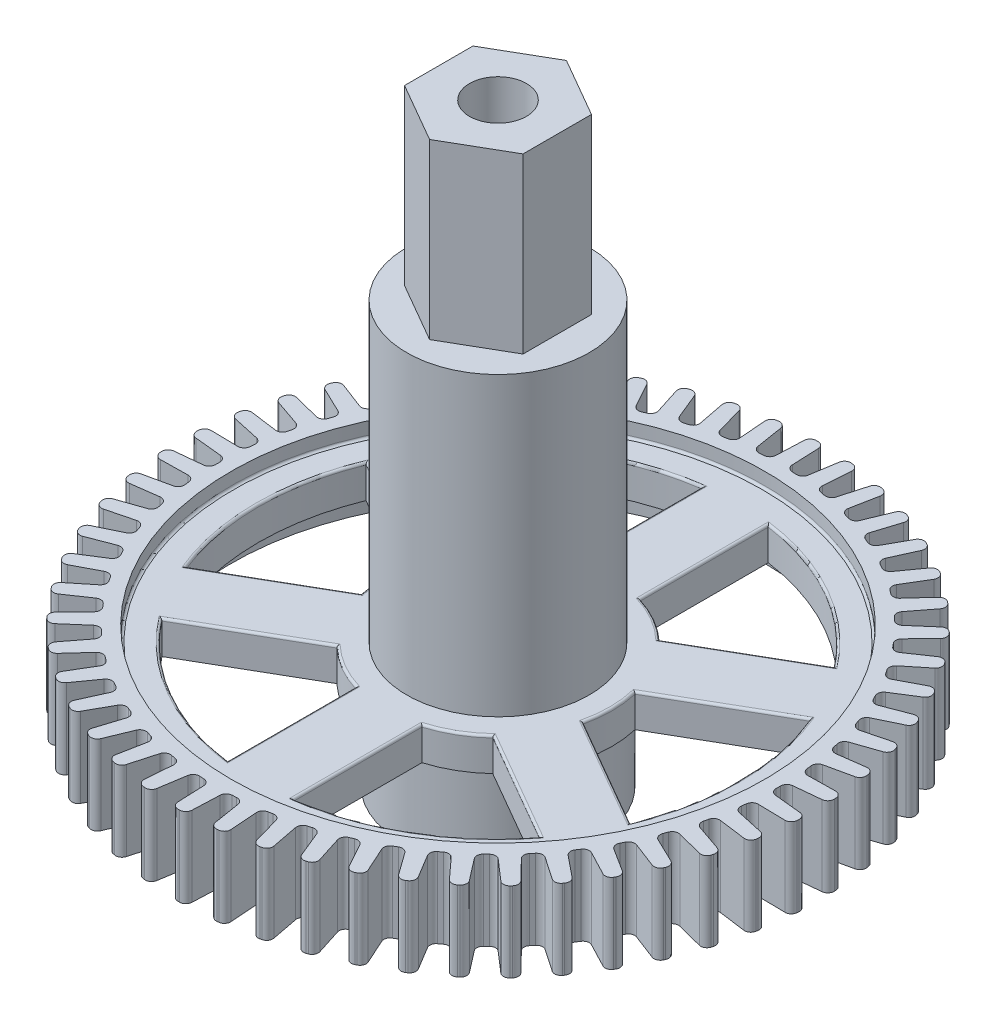
from build123d import *

# Parameters (mm, degrees)
RESSALTO_EXTRUS_O1_DEPTH = 3.5
ESBO_O2_R                = 11.7
CORTE_EXTRUS_O1_DEPTH    = 0.65
FILETE2_R                = 0.1
CORTE_EXTRUS_O2_DEPTH    = 20.983788233
FILETE3_R                = 0.1
CORTE_EXTRUS_O3_START    = -1.4
ESBO_O4_R                = 11.7
CORTE_EXTRUS_O3_DEPTH    = 1.4
ESBO_O5_R                = 4.25
RESSALTO_EXTRUS_O2_DEPTH = 4
ESBO_O6_R                = 4
RESSALTO_EXTRUS_O3_DEPTH = 13
RESSALTO_EXTRUS_O4_DEPTH = 7.6
ESBO_O8_R                = 1.25
CORTE_EXTRUS_O4_DEPTH    = 33.708283234


with BuildPart() as part:
    # Esboço1 → Ressalto-extrusão1 (new body)
    with BuildSketch(Plane(origin=(0, 0, 0), x_dir=(1, 0, 0), z_dir=(0, 1, 0))):
        with BuildLine():
            Line((0.036075499, 13.996785345), (-0.036075497, 13.996785345))
            ThreePointArc((-0.036075497, 13.996785345), (-0.226493402, 13.920194069), (-0.310843304, 13.733083684))
            Line((-0.310843304, 13.733083684), (-0.359771088, 12.543193769))
            ThreePointArc((-0.359771088, 12.543193769), (-0.438430885, 12.361705573), (-0.618549068, 12.279957365))
            Line((-0.618549068, 12.279957365), (-0.811249358, 12.268733852))
            ThreePointArc((-0.811249358, 12.268733852), (-0.999640035, 12.329018866), (-1.098837471, 12.500148053))
            Line((-1.098837471, 12.500148053), (-1.285572211, 13.676312191))
            ThreePointArc((-1.285572211, 13.676312191), (-1.391073959, 13.852364976), (-1.58909603, 13.9063322))
            Line((-1.58909603, 13.9063322), (-1.660759167, 13.89795598))
            ThreePointArc((-1.660759167, 13.89795598), (-1.840997829, 13.799776417), (-1.903055198, 13.604138781))
            Line((-1.903055198, 13.604138781), (-1.813514362, 12.416614306))
            ThreePointArc((-1.813514362, 12.416614306), (-1.870572796, 12.227221423), (-2.039982696, 12.125115523))
            Line((-2.039982696, 12.125115523), (-2.230077045, 12.091596761))
            ThreePointArc((-2.230077045, 12.091596761), (-2.424192555, 12.129603326), (-2.542586139, 12.28805928))
            Line((-2.542586139, 12.28805928), (-2.864602568, 13.434592036))
            ThreePointArc((-2.864602568, 13.434592036), (-2.989829432, 13.59720641), (-3.192777761, 13.627819767))
            Line((-3.192777761, 13.627819767), (-3.262983918, 13.611180603))
            ThreePointArc((-3.262983918, 13.611180603), (-3.430605919, 13.492740463), (-3.469531534, 13.291221237))
            Line((-3.469531534, 13.291221237), (-3.242732965, 12.122121435))
            ThreePointArc((-3.242732965, 12.122121435), (-3.277418418, 11.927385079), (-3.433829058, 11.806302293))
            Line((-3.433829058, 11.806302293), (-3.618746766, 11.750941566))
            ThreePointArc((-3.618746766, 11.750941566), (-3.81596203, 11.766155709), (-3.951950692, 11.909795585))
            Line((-3.951950692, 11.909795585), (-4.40489409, 13.011192071))
            ThreePointArc((-4.40489409, 13.011192071), (-4.548152591, 13.158168953), (-4.75328265, 13.165014451))
            Line((-4.75328265, 13.165014451), (-4.821082408, 13.140337357))
            ThreePointArc((-4.821082408, 13.140337357), (-4.973820949, 13.003238341), (-4.989088409, 12.798562728))
            Line((-4.989088409, 12.798562728), (-4.628099168, 11.663697667))
            ThreePointArc((-4.628099168, 11.663697667), (-4.639942579, 11.466251313), (-4.781238773, 11.327829079))
            Line((-4.781238773, 11.327829079), (-4.958479146, 11.251375046))
            ThreePointArc((-4.958479146, 11.251375046), (-5.156127164, 11.243591022), (-5.307871891, 11.370472335))
            Line((-5.307871891, 11.370472335), (-5.885616975, 12.411838053))
            ThreePointArc((-5.885616975, 12.411838053), (-6.044969788, 12.541189833), (-6.249507545, 12.524174898))
            Line((-6.249507545, 12.524174898), (-6.31398403, 12.49179359))
            ThreePointArc((-6.31398403, 12.49179359), (-6.449773583, 12.337889727), (-6.441176422, 12.132825613))
            Line((-6.441176422, 12.132825613), (-5.950878268, 11.047542397))
            ThreePointArc((-5.950878268, 11.047542397), (-5.939719476, 10.850056168), (-6.063990435, 10.696166409))
            Line((-6.063990435, 10.696166409), (-6.2311566, 10.599652979))
            ThreePointArc((-6.2311566, 10.599652979), (-6.426564523, 10.568976053), (-6.592013229, 10.677382954))
            Line((-6.592013229, 10.677382954), (-7.286746988, 11.644635219))
            ThreePointArc((-7.286746988, 11.644635219), (-7.460039139, 11.754612636), (-7.661218572, 11.713967365))
            Line((-7.661218572, 11.713967365), (-7.72149985, 11.674319745))
            ThreePointArc((-7.72149985, 11.674319745), (-7.838504094, 11.505692319), (-7.806158573, 11.303012845))
            Line((-7.806158573, 11.303012845), (-7.193181949, 10.281988068))
            ThreePointArc((-7.193181949, 10.281988068), (-7.159171857, 10.087132627), (-7.264737029, 9.919856437))
            Line((-7.264737029, 9.919856437), (-7.419568352, 9.804588789))
            ThreePointArc((-7.419568352, 9.804588789), (-7.610093622, 9.751433815), (-7.787008896, 9.839900284))
            Line((-7.787008896, 9.839900284), (-8.589336248, 10.719958669))
            ThreePointArc((-8.589336248, 10.719958669), (-8.774224259, 10.809074467), (-8.96932476, 10.745348519))
            Line((-8.96932476, 10.745348519), (-9.02459563, 10.698970753))
            ThreePointArc((-9.02459563, 10.698970753), (-9.121232284, 10.517900161), (-9.065575821, 10.320346219))
            Line((-9.065575821, 10.320346219), (-8.338210184, 9.377387488))
            ThreePointArc((-8.338210184, 9.377387488), (-8.28180872, 9.187797921), (-8.367240518, 9.009397425))
            Line((-8.367240518, 9.009397425), (-8.507643169, 8.876934356))
            ThreePointArc((-8.507643169, 8.876934356), (-8.69070926, 8.802020163), (-8.876698626, 8.869349843))
            Line((-8.876698626, 8.869349843), (-9.77576947, 9.650313068))
            ThreePointArc((-9.77576947, 9.650313068), (-9.969753047, 9.717362109), (-10.156136217, 9.631417267))
            Line((-10.156136217, 9.631417267), (-10.205649235, 9.578936534))
            ThreePointArc((-10.205649235, 9.578936534), (-10.280611454, 9.387871447), (-10.202396708, 9.198114615))
            Line((-10.202396708, 9.198114615), (-9.37047843, 8.34597383))
            ThreePointArc((-9.37047843, 8.34597383), (-9.292448327, 8.16421401), (-9.356591432, 7.977101767))
            Line((-9.356591432, 7.977101767), (-9.480666707, 7.829234614))
            ThreePointArc((-9.480666707, 7.829234614), (-9.653797964, 7.733574287), (-9.846346235, 7.778856661))
            Line((-9.846346235, 7.778856661), (-10.830002181, 8.450163537))
            ThreePointArc((-10.830002181, 8.450163537), (-11.030458028, 8.494239098), (-11.205603355, 8.38723762))
            Line((-11.205603355, 8.38723762), (-11.248688943, 8.329363632))
            ThreePointArc((-11.248688943, 8.329363632), (-11.300962991, 8.130887876), (-11.201247681, 7.951494289))
            Line((-11.201247681, 7.951494289), (-10.27602703, 7.201695193))
            ThreePointArc((-10.27602703, 7.201695193), (-10.177423512, 7.03022311), (-10.219410499, 6.836929493))
            Line((-10.219410499, 6.836929493), (-10.325480492, 6.675657904))
            ThreePointArc((-10.325480492, 6.675657904), (-10.486335612, 6.560545086), (-10.682838903, 6.583167788))
            Line((-10.682838903, 6.583167788), (-11.73777769, 7.135740041))
            ThreePointArc((-11.73777769, 7.135740041), (-11.941994988, 7.156246076), (-12.103533931, 7.029634971))
            Line((-12.103533931, 7.029634971), (-12.139609429, 6.967150375))
            ThreePointArc((-12.139609429, 6.967150375), (-12.16848839, 6.763947995), (-12.048620995, 6.597343644))
            Line((-12.048620995, 6.597343644), (-11.042609993, 5.960025983))
            ThreePointArc((-11.042609993, 5.960025983), (-10.924766502, 5.801160502), (-10.94402957, 5.604299476))
            Line((-10.94402957, 5.604299476), (-11.030659867, 5.431804373))
            ThreePointArc((-11.030659867, 5.431804373), (-11.177063559, 5.298795768), (-11.374864501, 5.298452863))
            Line((-11.374864501, 5.298452863), (-12.486819892, 5.724817903))
            ThreePointArc((-12.486819892, 5.724817903), (-12.692036951, 5.721477101), (-12.837784973, 5.576968569))
            Line((-12.837784973, 5.576968569), (-12.866362523, 5.510718362))
            ThreePointArc((-12.866362523, 5.510718362), (-12.871455859, 5.30553732), (-12.733057379, 5.153975244))
            Line((-12.733057379, 5.153975244), (-11.659860599, 4.637757646))
            ThreePointArc((-11.659860599, 4.637757646), (-11.524370768, 4.493647151), (-11.520649415, 4.295880923))
            Line((-11.520649415, 4.295880923), (-11.58666849, 4.114495007))
            ThreePointArc((-11.58666849, 4.114495007), (-11.716640896, 3.965389327), (-11.913064569, 3.942085452))
            Line((-11.913064569, 3.942085452), (-13.066999277, 4.236477423))
            ThreePointArc((-13.066999277, 4.236477423), (-13.270440887, 4.209334964), (-13.398426997, 4.048883234))
            Line((-13.398426997, 4.048883234), (-13.419120136, 3.979763336))
            ThreePointArc((-13.419120136, 3.979763336), (-13.400358967, 3.775378355), (-13.245301006, 3.640908171))
            Line((-13.245301006, 3.640908171), (-12.119431593, 3.252771592))
            ThreePointArc((-12.119431593, 3.252771592), (-11.968127688, 3.12536493), (-11.94147224, 2.92936795))
            Line((-11.94147224, 2.92936795), (-11.985987298, 2.741544154))
            ThreePointArc((-11.985987298, 2.741544154), (-12.097770764, 2.578357797), (-12.290160876, 2.532408099))
            Line((-12.290160876, 2.532408099), (-13.470469912, 2.690845853))
            ThreePointArc((-13.470469912, 2.690845853), (-13.669384876, 2.640268793), (-13.777878281, 2.466043699))
            Line((-13.777878281, 2.466043699), (-13.79040717, 2.394988839))
            ThreePointArc((-13.79040717, 2.394988839), (-13.748045209, 2.194163875), (-13.578424659, 2.07860406))
            Line((-13.578424659, 2.07860406), (-12.415108066, 1.823797383))
            ThreePointArc((-12.415108066, 1.823797383), (-12.250036213, 1.714817511), (-12.200807138, 1.523240301))
            Line((-12.200807138, 1.523240301), (-12.22321619, 1.331518619))
            ThreePointArc((-12.22321619, 1.331518619), (-12.315299036, 1.156458402), (-12.501053841, 1.08848427))
            Line((-12.501053841, 1.08848427), (-13.69177555, 1.108825209))
            ThreePointArc((-13.69177555, 1.108825209), (-13.883473884, 1.035497515), (-13.971007396, 0.849855154))
            Line((-13.971007396, 0.849855154), (-13.975202603, 0.777826226))
            ThreePointArc((-13.975202603, 0.777826226), (-13.909812724, 0.583277092), (-13.727923411, 0.488190395))
            Line((-13.727923411, 0.488190395), (-12.542891499, 0.370159443))
            ThreePointArc((-12.542891499, 0.370159443), (-12.366284012, 0.281080126), (-12.295147051, 0.096513439))
            Line((-12.295147051, 0.096513439), (-12.295147051, -0.096513421))
            ThreePointArc((-12.295147051, -0.096513421), (-12.366284016, -0.28108011), (-12.542891498, -0.370159442))
            Line((-12.542891498, -0.370159442), (-13.727923411, -0.488190393))
            ThreePointArc((-13.727923411, -0.488190393), (-13.909812724, -0.58327709), (-13.975202603, -0.777826224))
            Line((-13.975202603, -0.777826224), (-13.971007396, -0.849855152))
            ThreePointArc((-13.971007396, -0.849855152), (-13.883473884, -1.035497513), (-13.69177555, -1.108825207))
            Line((-13.69177555, -1.108825207), (-12.501053842, -1.088484268))
            ThreePointArc((-12.501053842, -1.088484268), (-12.315299035, -1.156458385), (-12.223216191, -1.331518601))
            Line((-12.223216191, -1.331518601), (-12.200807141, -1.523240283))
            ThreePointArc((-12.200807141, -1.523240283), (-12.250036218, -1.714817495), (-12.415108065, -1.823797381))
            Line((-12.415108065, -1.823797381), (-13.578424659, -2.078604058))
            ThreePointArc((-13.578424659, -2.078604058), (-13.748045209, -2.194163873), (-13.79040717, -2.394988837))
            Line((-13.79040717, -2.394988837), (-13.777878281, -2.466043698))
            ThreePointArc((-13.777878281, -2.466043698), (-13.669384876, -2.640268791), (-13.470469912, -2.690845851))
            Line((-13.470469912, -2.690845851), (-12.290160878, -2.532408097))
            ThreePointArc((-12.290160878, -2.532408097), (-12.097770764, -2.57835778), (-11.985987301, -2.741544136))
            Line((-11.985987301, -2.741544136), (-11.941472245, -2.929367933))
            ThreePointArc((-11.941472245, -2.929367933), (-11.968127696, -3.125364915), (-12.119431593, -3.25277159))
            Line((-12.119431593, -3.25277159), (-13.245301006, -3.640908169))
            ThreePointArc((-13.245301006, -3.640908169), (-13.400358968, -3.775378354), (-13.419120137, -3.979763335))
            Line((-13.419120137, -3.979763335), (-13.398426998, -4.048883233))
            ThreePointArc((-13.398426998, -4.048883233), (-13.270440888, -4.209334962), (-13.066999277, -4.236477421))
            Line((-13.066999277, -4.236477421), (-11.913064571, -3.942085451))
            ThreePointArc((-11.913064571, -3.942085451), (-11.716640898, -3.96538931), (-11.586668495, -4.11449499))
            Line((-11.586668495, -4.11449499), (-11.520649421, -4.295880907))
            ThreePointArc((-11.520649421, -4.295880907), (-11.524370777, -4.493647136), (-11.659860599, -4.637757644))
            Line((-11.659860599, -4.637757644), (-12.73305738, -5.153975243))
            ThreePointArc((-12.73305738, -5.153975243), (-12.871455859, -5.305537319), (-12.866362524, -5.510718361))
            Line((-12.866362524, -5.510718361), (-12.837784974, -5.576968568))
            ThreePointArc((-12.837784974, -5.576968568), (-12.692036951, -5.7214771), (-12.486819893, -5.724817901))
            Line((-12.486819893, -5.724817901), (-11.374864502, -5.298452862))
            ThreePointArc((-11.374864502, -5.298452862), (-11.177063563, -5.298795751), (-11.030659874, -5.431804357))
            Line((-11.030659874, -5.431804357), (-10.944029578, -5.604299461))
            ThreePointArc((-10.944029578, -5.604299461), (-10.924766513, -5.801160489), (-11.042609993, -5.960025981))
            Line((-11.042609993, -5.960025981), (-12.048620996, -6.597343643))
            ThreePointArc((-12.048620996, -6.597343643), (-12.168488391, -6.763947993), (-12.13960943, -6.967150374))
            Line((-12.13960943, -6.967150374), (-12.103533932, -7.02963497))
            ThreePointArc((-12.103533932, -7.02963497), (-11.941994988, -7.156246074), (-11.737777691, -7.13574004))
            Line((-11.737777691, -7.13574004), (-10.682838905, -6.583167787))
            ThreePointArc((-10.682838905, -6.583167787), (-10.486335618, -6.560545071), (-10.325480502, -6.675657889))
            Line((-10.325480502, -6.675657889), (-10.219410509, -6.836929479))
            ThreePointArc((-10.219410509, -6.836929479), (-10.177423524, -7.030223098), (-10.27602703, -7.201695191))
            Line((-10.27602703, -7.201695191), (-11.201247682, -7.951494288))
            ThreePointArc((-11.201247682, -7.951494288), (-11.300962992, -8.130887875), (-11.248688944, -8.329363631))
            Line((-11.248688944, -8.329363631), (-11.205603356, -8.387237618))
            ThreePointArc((-11.205603356, -8.387237618), (-11.030458029, -8.494239097), (-10.830002182, -8.450163536))
            Line((-10.830002182, -8.450163536), (-9.846346237, -7.778856661))
            ThreePointArc((-9.846346237, -7.778856661), (-9.653797972, -7.733574272), (-9.480666718, -7.829234599))
            Line((-9.480666718, -7.829234599), (-9.356591445, -7.977101754))
            ThreePointArc((-9.356591445, -7.977101754), (-9.292448341, -8.164213999), (-9.37047843, -8.345973828))
            Line((-9.37047843, -8.345973828), (-10.202396709, -9.198114614))
            ThreePointArc((-10.202396709, -9.198114614), (-10.280611455, -9.387871446), (-10.205649236, -9.578936533))
            Line((-10.205649236, -9.578936533), (-10.156136218, -9.631417266))
            ThreePointArc((-10.156136218, -9.631417266), (-9.969753048, -9.717362108), (-9.775769472, -9.650313067))
            Line((-9.775769472, -9.650313067), (-8.876698628, -8.869349843))
            ThreePointArc((-8.876698628, -8.869349843), (-8.69070927, -8.802020148), (-8.507643182, -8.876934343))
            Line((-8.507643182, -8.876934343), (-8.367240532, -9.009397413))
            ThreePointArc((-8.367240532, -9.009397413), (-8.281808734, -9.187797912), (-8.338210184, -9.377387486))
            Line((-8.338210184, -9.377387486), (-9.065575822, -10.320346218))
            ThreePointArc((-9.065575822, -10.320346218), (-9.121232285, -10.51790016), (-9.024595631, -10.698970751))
            Line((-9.024595631, -10.698970751), (-8.969324761, -10.745348518))
            ThreePointArc((-8.969324761, -10.745348518), (-8.77422426, -10.809074466), (-8.58933625, -10.719958668))
            Line((-8.58933625, -10.719958668), (-7.787008898, -9.839900284))
            ThreePointArc((-7.787008898, -9.839900284), (-7.610093634, -9.751433802), (-7.419568366, -9.804588778))
            Line((-7.419568366, -9.804588778), (-7.264737044, -9.919856427))
            ThreePointArc((-7.264737044, -9.919856427), (-7.159171873, -10.08713262), (-7.19318195, -10.281988066))
            Line((-7.19318195, -10.281988066), (-7.806158574, -11.303012844))
            ThreePointArc((-7.806158574, -11.303012844), (-7.838504095, -11.505692318), (-7.721499851, -11.674319744))
            Line((-7.721499851, -11.674319744), (-7.661218573, -11.713967365))
            ThreePointArc((-7.661218573, -11.713967365), (-7.460039141, -11.754612635), (-7.28674699, -11.644635218))
            Line((-7.28674699, -11.644635218), (-6.592013231, -10.677382954))
            ThreePointArc((-6.592013231, -10.677382954), (-6.426564536, -10.568976042), (-6.231156616, -10.599652969))
            Line((-6.231156616, -10.599652969), (-6.063990451, -10.6961664))
            ThreePointArc((-6.063990451, -10.6961664), (-5.939719492, -10.850056163), (-5.950878269, -11.047542395))
            Line((-5.950878269, -11.047542395), (-6.441176423, -12.132825612))
            ThreePointArc((-6.441176423, -12.132825612), (-6.449773585, -12.337889726), (-6.313984032, -12.49179359))
            Line((-6.313984032, -12.49179359), (-6.249507546, -12.524174898))
            ThreePointArc((-6.249507546, -12.524174898), (-6.04496979, -12.541189833), (-5.885616977, -12.411838053))
            Line((-5.885616977, -12.411838053), (-5.307871893, -11.370472336))
            ThreePointArc((-5.307871893, -11.370472336), (-5.156127178, -11.243591012), (-4.958479162, -11.251375038))
            Line((-4.958479162, -11.251375038), (-4.781238789, -11.327829072))
            ThreePointArc((-4.781238789, -11.327829072), (-4.639942596, -11.46625131), (-4.628099169, -11.663697665))
            Line((-4.628099169, -11.663697665), (-4.989088411, -12.798562727))
            ThreePointArc((-4.989088411, -12.798562727), (-4.97382095, -13.00323834), (-4.82108241, -13.140337356))
            Line((-4.82108241, -13.140337356), (-4.753282651, -13.16501445))
            ThreePointArc((-4.753282651, -13.16501445), (-4.548152592, -13.158168952), (-4.404894091, -13.01119207))
            Line((-4.404894091, -13.01119207), (-3.951950694, -11.909795585))
            ThreePointArc((-3.951950694, -11.909795585), (-3.815962044, -11.766155701), (-3.618746783, -11.75094156))
            Line((-3.618746783, -11.75094156), (-3.433829075, -11.806302289))
            ThreePointArc((-3.433829075, -11.806302289), (-3.277418435, -11.927385078), (-3.242732966, -12.122121434))
            Line((-3.242732966, -12.122121434), (-3.469531536, -13.291221237))
            ThreePointArc((-3.469531536, -13.291221237), (-3.430605921, -13.492740463), (-3.262983919, -13.611180602))
            Line((-3.262983919, -13.611180602), (-3.192777762, -13.627819767))
            ThreePointArc((-3.192777762, -13.627819767), (-2.989829433, -13.597206409), (-2.864602569, -13.434592036))
            Line((-2.864602569, -13.434592036), (-2.542586141, -12.288059281))
            ThreePointArc((-2.542586141, -12.288059281), (-2.424192571, -12.129603319), (-2.230077063, -12.091596757))
            Line((-2.230077063, -12.091596757), (-2.039982714, -12.12511552))
            ThreePointArc((-2.039982714, -12.12511552), (-1.870572813, -12.227221424), (-1.813514363, -12.416614305))
            Line((-1.813514363, -12.416614305), (-1.903055199, -13.60413878))
            ThreePointArc((-1.903055199, -13.60413878), (-1.840997831, -13.799776417), (-1.660759168, -13.89795598))
            Line((-1.660759168, -13.89795598), (-1.589096031, -13.9063322))
            ThreePointArc((-1.589096031, -13.9063322), (-1.39107396, -13.852364976), (-1.285572212, -13.676312191))
            Line((-1.285572212, -13.676312191), (-1.098837472, -12.500148054))
            ThreePointArc((-1.098837472, -12.500148054), (-0.999640051, -12.329018861), (-0.811249376, -12.26873385))
            Line((-0.811249376, -12.26873385), (-0.618549086, -12.279957365))
            ThreePointArc((-0.618549086, -12.279957365), (-0.438430902, -12.361705575), (-0.35977109, -12.543193768))
            Line((-0.35977109, -12.543193768), (-0.310843306, -13.733083684))
            ThreePointArc((-0.310843306, -13.733083684), (-0.226493403, -13.920194069), (-0.036075499, -13.996785345))
            Line((-0.036075499, -13.996785345), (0.036075497, -13.996785345))
            ThreePointArc((0.036075497, -13.996785345), (0.226493402, -13.920194069), (0.310843304, -13.733083684))
            Line((0.310843304, -13.733083684), (0.359771088, -12.543193769))
            ThreePointArc((0.359771088, -12.543193769), (0.438430885, -12.361705573), (0.618549068, -12.279957365))
            Line((0.618549068, -12.279957365), (0.811249358, -12.268733852))
            ThreePointArc((0.811249358, -12.268733852), (0.999640035, -12.329018866), (1.098837471, -12.500148053))
            Line((1.098837471, -12.500148053), (1.285572211, -13.676312191))
            ThreePointArc((1.285572211, -13.676312191), (1.391073959, -13.852364976), (1.58909603, -13.9063322))
            Line((1.58909603, -13.9063322), (1.660759167, -13.89795598))
            ThreePointArc((1.660759167, -13.89795598), (1.840997829, -13.799776417), (1.903055198, -13.604138781))
            Line((1.903055198, -13.604138781), (1.813514362, -12.416614306))
            ThreePointArc((1.813514362, -12.416614306), (1.870572796, -12.227221423), (2.039982696, -12.125115523))
            Line((2.039982696, -12.125115523), (2.230077045, -12.091596761))
            ThreePointArc((2.230077045, -12.091596761), (2.424192555, -12.129603326), (2.542586139, -12.28805928))
            Line((2.542586139, -12.28805928), (2.864602568, -13.434592036))
            ThreePointArc((2.864602568, -13.434592036), (2.989829432, -13.59720641), (3.192777761, -13.627819767))
            Line((3.192777761, -13.627819767), (3.262983918, -13.611180603))
            ThreePointArc((3.262983918, -13.611180603), (3.430605919, -13.492740463), (3.469531534, -13.291221237))
            Line((3.469531534, -13.291221237), (3.242732965, -12.122121435))
            ThreePointArc((3.242732965, -12.122121435), (3.277418418, -11.927385079), (3.433829058, -11.806302293))
            Line((3.433829058, -11.806302293), (3.618746766, -11.750941566))
            ThreePointArc((3.618746766, -11.750941566), (3.81596203, -11.766155709), (3.951950692, -11.909795585))
            Line((3.951950692, -11.909795585), (4.40489409, -13.011192071))
            ThreePointArc((4.40489409, -13.011192071), (4.548152591, -13.158168953), (4.75328265, -13.165014451))
            Line((4.75328265, -13.165014451), (4.821082409, -13.140337357))
            ThreePointArc((4.821082409, -13.140337357), (4.973820949, -13.003238341), (4.989088409, -12.798562728))
            Line((4.989088409, -12.798562728), (4.628099168, -11.663697667))
            ThreePointArc((4.628099168, -11.663697667), (4.639942579, -11.466251313), (4.781238773, -11.327829079))
            Line((4.781238773, -11.327829079), (4.958479146, -11.251375046))
            ThreePointArc((4.958479146, -11.251375046), (5.156127164, -11.243591022), (5.307871891, -11.370472335))
            Line((5.307871891, -11.370472335), (5.885616975, -12.411838053))
            ThreePointArc((5.885616975, -12.411838053), (6.044969788, -12.541189833), (6.249507545, -12.524174898))
            Line((6.249507545, -12.524174898), (6.31398403, -12.49179359))
            ThreePointArc((6.31398403, -12.49179359), (6.449773583, -12.337889727), (6.441176422, -12.132825613))
            Line((6.441176422, -12.132825613), (5.950878268, -11.047542397))
            ThreePointArc((5.950878268, -11.047542397), (5.939719476, -10.850056168), (6.063990435, -10.696166409))
            Line((6.063990435, -10.696166409), (6.2311566, -10.599652979))
            ThreePointArc((6.2311566, -10.599652979), (6.426564523, -10.568976053), (6.592013229, -10.677382954))
            Line((6.592013229, -10.677382954), (7.286746988, -11.644635219))
            ThreePointArc((7.286746988, -11.644635219), (7.460039139, -11.754612636), (7.661218572, -11.713967365))
            Line((7.661218572, -11.713967365), (7.72149985, -11.674319745))
            ThreePointArc((7.72149985, -11.674319745), (7.838504094, -11.505692319), (7.806158573, -11.303012845))
            Line((7.806158573, -11.303012845), (7.193181949, -10.281988068))
            ThreePointArc((7.193181949, -10.281988068), (7.159171857, -10.087132627), (7.264737029, -9.919856437))
            Line((7.264737029, -9.919856437), (7.419568352, -9.804588789))
            ThreePointArc((7.419568352, -9.804588789), (7.610093622, -9.751433815), (7.787008896, -9.839900284))
            Line((7.787008896, -9.839900284), (8.589336248, -10.719958669))
            ThreePointArc((8.589336248, -10.719958669), (8.774224259, -10.809074467), (8.96932476, -10.745348519))
            Line((8.96932476, -10.745348519), (9.02459563, -10.698970753))
            ThreePointArc((9.02459563, -10.698970753), (9.121232284, -10.517900161), (9.065575821, -10.320346219))
            Line((9.065575821, -10.320346219), (8.338210184, -9.377387488))
            ThreePointArc((8.338210184, -9.377387488), (8.28180872, -9.187797921), (8.367240518, -9.009397425))
            Line((8.367240518, -9.009397425), (8.507643169, -8.876934356))
            ThreePointArc((8.507643169, -8.876934356), (8.69070926, -8.802020163), (8.876698626, -8.869349843))
            Line((8.876698626, -8.869349843), (9.77576947, -9.650313068))
            ThreePointArc((9.77576947, -9.650313068), (9.969753047, -9.717362109), (10.156136217, -9.631417267))
            Line((10.156136217, -9.631417267), (10.205649235, -9.578936534))
            ThreePointArc((10.205649235, -9.578936534), (10.280611454, -9.387871447), (10.202396708, -9.198114615))
            Line((10.202396708, -9.198114615), (9.37047843, -8.34597383))
            ThreePointArc((9.37047843, -8.34597383), (9.292448327, -8.16421401), (9.356591432, -7.977101767))
            Line((9.356591432, -7.977101767), (9.480666707, -7.829234614))
            ThreePointArc((9.480666707, -7.829234614), (9.653797964, -7.733574287), (9.846346235, -7.778856661))
            Line((9.846346235, -7.778856661), (10.830002181, -8.450163537))
            ThreePointArc((10.830002181, -8.450163537), (11.030458029, -8.494239098), (11.205603355, -8.38723762))
            Line((11.205603355, -8.38723762), (11.248688943, -8.329363632))
            ThreePointArc((11.248688943, -8.329363632), (11.300962991, -8.130887876), (11.201247681, -7.951494289))
            Line((11.201247681, -7.951494289), (10.27602703, -7.201695193))
            ThreePointArc((10.27602703, -7.201695193), (10.177423512, -7.03022311), (10.219410499, -6.836929493))
            Line((10.219410499, -6.836929493), (10.325480492, -6.675657904))
            ThreePointArc((10.325480492, -6.675657904), (10.486335612, -6.560545086), (10.682838903, -6.583167788))
            Line((10.682838903, -6.583167788), (11.73777769, -7.135740041))
            ThreePointArc((11.73777769, -7.135740041), (11.941994988, -7.156246076), (12.103533931, -7.029634971))
            Line((12.103533931, -7.029634971), (12.139609429, -6.967150375))
            ThreePointArc((12.139609429, -6.967150375), (12.16848839, -6.763947995), (12.048620995, -6.597343644))
            Line((12.048620995, -6.597343644), (11.042609993, -5.960025983))
            ThreePointArc((11.042609993, -5.960025983), (10.924766502, -5.801160502), (10.94402957, -5.604299476))
            Line((10.94402957, -5.604299476), (11.030659867, -5.431804373))
            ThreePointArc((11.030659867, -5.431804373), (11.177063559, -5.298795768), (11.374864501, -5.298452863))
            Line((11.374864501, -5.298452863), (12.486819893, -5.724817903))
            ThreePointArc((12.486819893, -5.724817903), (12.692036951, -5.721477101), (12.837784973, -5.576968569))
            Line((12.837784973, -5.576968569), (12.866362523, -5.510718362))
            ThreePointArc((12.866362523, -5.510718362), (12.871455859, -5.30553732), (12.733057379, -5.153975244))
            Line((12.733057379, -5.153975244), (11.659860599, -4.637757646))
            ThreePointArc((11.659860599, -4.637757646), (11.524370768, -4.493647151), (11.520649415, -4.295880923))
            Line((11.520649415, -4.295880923), (11.58666849, -4.114495007))
            ThreePointArc((11.58666849, -4.114495007), (11.716640896, -3.965389327), (11.913064569, -3.942085452))
            Line((11.913064569, -3.942085452), (13.066999277, -4.236477423))
            ThreePointArc((13.066999277, -4.236477423), (13.270440887, -4.209334964), (13.398426997, -4.048883234))
            Line((13.398426997, -4.048883234), (13.419120136, -3.979763336))
            ThreePointArc((13.419120136, -3.979763336), (13.400358967, -3.775378355), (13.245301006, -3.640908171))
            Line((13.245301006, -3.640908171), (12.119431593, -3.252771592))
            ThreePointArc((12.119431593, -3.252771592), (11.968127688, -3.12536493), (11.94147224, -2.92936795))
            Line((11.94147224, -2.92936795), (11.985987298, -2.741544154))
            ThreePointArc((11.985987298, -2.741544154), (12.097770764, -2.578357797), (12.290160876, -2.532408099))
            Line((12.290160876, -2.532408099), (13.470469912, -2.690845853))
            ThreePointArc((13.470469912, -2.690845853), (13.669384876, -2.640268793), (13.777878281, -2.466043699))
            Line((13.777878281, -2.466043699), (13.79040717, -2.394988839))
            ThreePointArc((13.79040717, -2.394988839), (13.748045209, -2.194163875), (13.578424659, -2.07860406))
            Line((13.578424659, -2.07860406), (12.415108066, -1.823797383))
            ThreePointArc((12.415108066, -1.823797383), (12.250036213, -1.714817511), (12.200807138, -1.523240301))
            Line((12.200807138, -1.523240301), (12.22321619, -1.331518619))
            ThreePointArc((12.22321619, -1.331518619), (12.315299036, -1.156458402), (12.501053841, -1.08848427))
            Line((12.501053841, -1.08848427), (13.69177555, -1.108825209))
            ThreePointArc((13.69177555, -1.108825209), (13.883473884, -1.035497515), (13.971007396, -0.849855154))
            Line((13.971007396, -0.849855154), (13.975202603, -0.777826226))
            ThreePointArc((13.975202603, -0.777826226), (13.909812724, -0.583277092), (13.727923411, -0.488190395))
            Line((13.727923411, -0.488190395), (12.542891499, -0.370159443))
            ThreePointArc((12.542891499, -0.370159443), (12.366284012, -0.281080126), (12.295147051, -0.096513439))
            Line((12.295147051, -0.096513439), (12.295147051, 0.096513421))
            ThreePointArc((12.295147051, 0.096513421), (12.366284016, 0.28108011), (12.542891498, 0.370159442))
            Line((12.542891498, 0.370159442), (13.727923411, 0.488190393))
            ThreePointArc((13.727923411, 0.488190393), (13.909812724, 0.58327709), (13.975202603, 0.777826224))
            Line((13.975202603, 0.777826224), (13.971007396, 0.849855152))
            ThreePointArc((13.971007396, 0.849855152), (13.883473884, 1.035497513), (13.69177555, 1.108825207))
            Line((13.69177555, 1.108825207), (12.501053842, 1.088484268))
            ThreePointArc((12.501053842, 1.088484268), (12.315299035, 1.156458385), (12.223216191, 1.331518601))
            Line((12.223216191, 1.331518601), (12.200807141, 1.523240283))
            ThreePointArc((12.200807141, 1.523240283), (12.250036218, 1.714817495), (12.415108065, 1.823797381))
            Line((12.415108065, 1.823797381), (13.578424659, 2.078604058))
            ThreePointArc((13.578424659, 2.078604058), (13.748045209, 2.194163873), (13.79040717, 2.394988837))
            Line((13.79040717, 2.394988837), (13.777878281, 2.466043698))
            ThreePointArc((13.777878281, 2.466043698), (13.669384876, 2.640268791), (13.470469912, 2.690845851))
            Line((13.470469912, 2.690845851), (12.290160878, 2.532408097))
            ThreePointArc((12.290160878, 2.532408097), (12.097770764, 2.57835778), (11.985987301, 2.741544136))
            Line((11.985987301, 2.741544136), (11.941472245, 2.929367933))
            ThreePointArc((11.941472245, 2.929367933), (11.968127696, 3.125364915), (12.119431593, 3.25277159))
            Line((12.119431593, 3.25277159), (13.245301006, 3.640908169))
            ThreePointArc((13.245301006, 3.640908169), (13.400358968, 3.775378354), (13.419120137, 3.979763335))
            Line((13.419120137, 3.979763335), (13.398426998, 4.048883233))
            ThreePointArc((13.398426998, 4.048883233), (13.270440888, 4.209334962), (13.066999277, 4.236477421))
            Line((13.066999277, 4.236477421), (11.913064571, 3.942085451))
            ThreePointArc((11.913064571, 3.942085451), (11.716640898, 3.96538931), (11.586668495, 4.11449499))
            Line((11.586668495, 4.11449499), (11.520649421, 4.295880907))
            ThreePointArc((11.520649421, 4.295880907), (11.524370777, 4.493647136), (11.659860599, 4.637757644))
            Line((11.659860599, 4.637757644), (12.73305738, 5.153975243))
            ThreePointArc((12.73305738, 5.153975243), (12.871455859, 5.305537319), (12.866362524, 5.510718361))
            Line((12.866362524, 5.510718361), (12.837784974, 5.576968568))
            ThreePointArc((12.837784974, 5.576968568), (12.692036951, 5.7214771), (12.486819893, 5.724817901))
            Line((12.486819893, 5.724817901), (11.374864502, 5.298452862))
            ThreePointArc((11.374864502, 5.298452862), (11.177063563, 5.298795751), (11.030659874, 5.431804357))
            Line((11.030659874, 5.431804357), (10.944029578, 5.604299461))
            ThreePointArc((10.944029578, 5.604299461), (10.924766513, 5.801160489), (11.042609993, 5.960025981))
            Line((11.042609993, 5.960025981), (12.048620996, 6.597343643))
            ThreePointArc((12.048620996, 6.597343643), (12.168488391, 6.763947993), (12.13960943, 6.967150374))
            Line((12.13960943, 6.967150374), (12.103533932, 7.02963497))
            ThreePointArc((12.103533932, 7.02963497), (11.941994988, 7.156246074), (11.737777691, 7.13574004))
            Line((11.737777691, 7.13574004), (10.682838905, 6.583167787))
            ThreePointArc((10.682838905, 6.583167787), (10.486335618, 6.560545071), (10.325480502, 6.675657889))
            Line((10.325480502, 6.675657889), (10.219410509, 6.836929479))
            ThreePointArc((10.219410509, 6.836929479), (10.177423524, 7.030223098), (10.27602703, 7.201695191))
            Line((10.27602703, 7.201695191), (11.201247682, 7.951494288))
            ThreePointArc((11.201247682, 7.951494288), (11.300962992, 8.130887875), (11.248688944, 8.329363631))
            Line((11.248688944, 8.329363631), (11.205603356, 8.387237618))
            ThreePointArc((11.205603356, 8.387237618), (11.030458029, 8.494239097), (10.830002182, 8.450163536))
            Line((10.830002182, 8.450163536), (9.846346237, 7.778856661))
            ThreePointArc((9.846346237, 7.778856661), (9.653797972, 7.733574272), (9.480666718, 7.829234599))
            Line((9.480666718, 7.829234599), (9.356591445, 7.977101754))
            ThreePointArc((9.356591445, 7.977101754), (9.292448341, 8.164213999), (9.37047843, 8.345973828))
            Line((9.37047843, 8.345973828), (10.202396709, 9.198114614))
            ThreePointArc((10.202396709, 9.198114614), (10.280611456, 9.387871446), (10.205649236, 9.578936533))
            Line((10.205649236, 9.578936533), (10.156136218, 9.631417266))
            ThreePointArc((10.156136218, 9.631417266), (9.969753048, 9.717362108), (9.775769472, 9.650313067))
            Line((9.775769472, 9.650313067), (8.876698628, 8.869349843))
            ThreePointArc((8.876698628, 8.869349843), (8.69070927, 8.802020148), (8.507643182, 8.876934343))
            Line((8.507643182, 8.876934343), (8.367240532, 9.009397413))
            ThreePointArc((8.367240532, 9.009397413), (8.281808734, 9.187797912), (8.338210184, 9.377387486))
            Line((8.338210184, 9.377387486), (9.065575822, 10.320346218))
            ThreePointArc((9.065575822, 10.320346218), (9.121232285, 10.51790016), (9.024595631, 10.698970751))
            Line((9.024595631, 10.698970751), (8.969324761, 10.745348518))
            ThreePointArc((8.969324761, 10.745348518), (8.77422426, 10.809074466), (8.58933625, 10.719958668))
            Line((8.58933625, 10.719958668), (7.787008898, 9.839900284))
            ThreePointArc((7.787008898, 9.839900284), (7.610093634, 9.751433802), (7.419568366, 9.804588778))
            Line((7.419568366, 9.804588778), (7.264737044, 9.919856427))
            ThreePointArc((7.264737044, 9.919856427), (7.159171873, 10.08713262), (7.19318195, 10.281988066))
            Line((7.19318195, 10.281988066), (7.806158574, 11.303012844))
            ThreePointArc((7.806158574, 11.303012844), (7.838504095, 11.505692318), (7.721499851, 11.674319744))
            Line((7.721499851, 11.674319744), (7.661218573, 11.713967365))
            ThreePointArc((7.661218573, 11.713967365), (7.460039141, 11.754612635), (7.28674699, 11.644635218))
            Line((7.28674699, 11.644635218), (6.592013231, 10.677382954))
            ThreePointArc((6.592013231, 10.677382954), (6.426564536, 10.568976042), (6.231156616, 10.599652969))
            Line((6.231156616, 10.599652969), (6.063990451, 10.6961664))
            ThreePointArc((6.063990451, 10.6961664), (5.939719492, 10.850056163), (5.950878269, 11.047542395))
            Line((5.950878269, 11.047542395), (6.441176423, 12.132825612))
            ThreePointArc((6.441176423, 12.132825612), (6.449773585, 12.337889726), (6.313984032, 12.49179359))
            Line((6.313984032, 12.49179359), (6.249507546, 12.524174898))
            ThreePointArc((6.249507546, 12.524174898), (6.04496979, 12.541189833), (5.885616977, 12.411838053))
            Line((5.885616977, 12.411838053), (5.307871893, 11.370472336))
            ThreePointArc((5.307871893, 11.370472336), (5.156127178, 11.243591012), (4.958479162, 11.251375038))
            Line((4.958479162, 11.251375038), (4.781238789, 11.327829072))
            ThreePointArc((4.781238789, 11.327829072), (4.639942596, 11.46625131), (4.628099169, 11.663697665))
            Line((4.628099169, 11.663697665), (4.989088411, 12.798562727))
            ThreePointArc((4.989088411, 12.798562727), (4.97382095, 13.00323834), (4.82108241, 13.140337356))
            Line((4.82108241, 13.140337356), (4.753282651, 13.16501445))
            ThreePointArc((4.753282651, 13.16501445), (4.548152592, 13.158168952), (4.404894091, 13.01119207))
            Line((4.404894091, 13.01119207), (3.951950694, 11.909795585))
            ThreePointArc((3.951950694, 11.909795585), (3.815962044, 11.766155701), (3.618746783, 11.75094156))
            Line((3.618746783, 11.75094156), (3.433829075, 11.806302289))
            ThreePointArc((3.433829075, 11.806302289), (3.277418435, 11.927385078), (3.242732966, 12.122121434))
            Line((3.242732966, 12.122121434), (3.469531536, 13.291221237))
            ThreePointArc((3.469531536, 13.291221237), (3.430605921, 13.492740463), (3.262983919, 13.611180602))
            Line((3.262983919, 13.611180602), (3.192777762, 13.627819767))
            ThreePointArc((3.192777762, 13.627819767), (2.989829433, 13.597206409), (2.864602569, 13.434592036))
            Line((2.864602569, 13.434592036), (2.542586141, 12.288059281))
            ThreePointArc((2.542586141, 12.288059281), (2.424192571, 12.129603319), (2.230077063, 12.091596757))
            Line((2.230077063, 12.091596757), (2.039982714, 12.12511552))
            ThreePointArc((2.039982714, 12.12511552), (1.870572813, 12.227221424), (1.813514363, 12.416614305))
            Line((1.813514363, 12.416614305), (1.903055199, 13.60413878))
            ThreePointArc((1.903055199, 13.60413878), (1.840997831, 13.799776417), (1.660759168, 13.89795598))
            Line((1.660759168, 13.89795598), (1.589096031, 13.9063322))
            ThreePointArc((1.589096031, 13.9063322), (1.39107396, 13.852364976), (1.285572212, 13.676312191))
            Line((1.285572212, 13.676312191), (1.098837472, 12.500148054))
            ThreePointArc((1.098837472, 12.500148054), (0.999640051, 12.329018861), (0.811249376, 12.26873385))
            Line((0.811249376, 12.26873385), (0.618549086, 12.279957365))
            ThreePointArc((0.618549086, 12.279957365), (0.438430902, 12.361705575), (0.35977109, 12.543193768))
            Line((0.35977109, 12.543193768), (0.310843306, 13.733083684))
            ThreePointArc((0.310843306, 13.733083684), (0.226493403, 13.920194069), (0.036075499, 13.996785345))
        make_face()
    extrude(amount=RESSALTO_EXTRUS_O1_DEPTH)

    # Esboço2 → Corte-extrusão1 (cut)
    with BuildSketch(Plane(origin=(0, 3.5, 0), x_dir=(1, 0, 0), z_dir=(0, 1, 0))):
        Circle(ESBO_O2_R)
    extrude(amount=-CORTE_EXTRUS_O1_DEPTH, mode=Mode.SUBTRACT)

    # Filete2
    filete2_edges = [part.edges().sort_by_distance(p)[0] for p in [
        (-11.7, 2.85, 0),
    ]]
    fillet(filete2_edges, radius=FILETE2_R)

    # Esboço3 → Corte-extrusão2 (cut, through all)
    with BuildSketch(Plane(origin=(0, 2.85, 0), x_dir=(1, 0, 0), z_dir=(0, 1, 0))):
        with BuildLine():
            Line((1.45, 4.785133227), (1.45, 10.399399021))
            ThreePointArc((1.45, 10.399399021), (5.25, 9.09326674), (8.281143736, 6.455436346))
            Line((8.281143736, 6.455436346), (3.419046935, 3.648303449))
            ThreePointArc((3.419046935, 3.648303449), (2.5, 4.330127019), (1.45, 4.785133227))
        make_face()
        with BuildLine():
            Line((-1.45, 4.785133227), (-1.45, 10.399399021))
            ThreePointArc((-1.45, 10.399399021), (-5.25, 9.09326674), (-8.281143736, 6.455436346))
            Line((-8.281143736, 6.455436346), (-3.419046935, 3.648303449))
            ThreePointArc((-3.419046935, 3.648303449), (-2.5, 4.330127019), (-1.45, 4.785133227))
        make_face()
        with BuildLine():
            Line((4.869046935, 1.136829778), (9.731143736, 3.943962675))
            ThreePointArc((9.731143736, 3.943962675), (10.5, 0), (9.731143736, -3.943962675))
            Line((9.731143736, -3.943962675), (4.869046935, -1.136829778))
            ThreePointArc((4.869046935, -1.136829778), (5, 0), (4.869046935, 1.136829778))
        make_face()
        with BuildLine():
            Line((3.419046935, -3.648303449), (8.281143736, -6.455436346))
            ThreePointArc((8.281143736, -6.455436346), (5.25, -9.09326674), (1.45, -10.399399021))
            Line((1.45, -10.399399021), (1.45, -4.785133227))
            ThreePointArc((1.45, -4.785133227), (2.5, -4.330127019), (3.419046935, -3.648303449))
        make_face()
        with BuildLine():
            Line((-1.45, -4.785133227), (-1.45, -10.399399021))
            ThreePointArc((-1.45, -10.399399021), (-5.25, -9.09326674), (-8.281143736, -6.455436346))
            Line((-8.281143736, -6.455436346), (-3.419046935, -3.648303449))
            ThreePointArc((-3.419046935, -3.648303449), (-2.5, -4.330127019), (-1.45, -4.785133227))
        make_face()
        with BuildLine():
            Line((-4.869046935, -1.136829778), (-9.731143736, -3.943962675))
            ThreePointArc((-9.731143736, -3.943962675), (-10.5, 0), (-9.731143736, 3.943962675))
            Line((-9.731143736, 3.943962675), (-4.869046935, 1.136829778))
            ThreePointArc((-4.869046935, 1.136829778), (-5, 0), (-4.869046935, -1.136829778))
        make_face()
    extrude(amount=-CORTE_EXTRUS_O2_DEPTH, mode=Mode.SUBTRACT)

    # Filete3
    filete3_edges = [part.edges().sort_by_distance(p)[0] for p in [
        (-1.45, 2.85, -7.592266124),
        (-5.25, 2.85, -9.09326674),
        (-5.850095336, 2.85, -5.051869898),
        (-2.5, 2.85, -4.330127019),
        (5.850095336, 2.85, -5.051869898),
        (5.25, 2.85, -9.09326674),
        (1.45, 2.85, -7.592266124),
        (2.5, 2.85, -4.330127019),
        (7.300095336, 2.85, 2.540396227),
        (10.5, 2.85, 0),
        (7.300095336, 2.85, -2.540396227),
        (5, 2.85, 0),
        (1.45, 2.85, 7.592266124),
        (5.25, 2.85, 9.09326674),
        (5.850095336, 2.85, 5.051869898),
        (2.5, 2.85, 4.330127019),
        (-5.850095336, 2.85, 5.051869898),
        (-5.25, 2.85, 9.09326674),
        (-1.45, 2.85, 7.592266124),
        (-2.5, 2.85, 4.330127019),
        (-7.300095336, 2.85, -2.540396227),
        (-10.5, 2.85, 0),
        (-7.300095336, 2.85, 2.540396227),
        (-5, 2.85, 0),
    ]]
    fillet(filete3_edges, radius=FILETE3_R)

    # Esboço4 → Corte-extrusão3 (cut)
    with BuildSketch(Plane.XZ.offset(CORTE_EXTRUS_O3_START)):
        Circle(ESBO_O4_R)
    extrude(amount=CORTE_EXTRUS_O3_DEPTH, mode=Mode.SUBTRACT)

    # Esboço5 → Ressalto-extrusão2 (add)
    with BuildSketch(Plane.XZ.offset(-1.4)):
        Circle(ESBO_O5_R)
    extrude(amount=RESSALTO_EXTRUS_O2_DEPTH)

    # Esboço6 → Ressalto-extrusão3 (add)
    with BuildSketch(Plane(origin=(0, 2.85, 0), x_dir=(1, 0, 0), z_dir=(0, 1, 0))):
        Circle(ESBO_O6_R)
    extrude(amount=RESSALTO_EXTRUS_O3_DEPTH)

    # Esboço7 → Ressalto-extrusão4 (add)
    with BuildSketch(Plane(origin=(0, 15.85, 0), x_dir=(1, 0, 0), z_dir=(0, 1, 0))):
        Polygon((0, 3), (-2.598076211, 1.5), (-2.598076211, -1.5), (0, -3), (2.598076211, -1.5), (2.598076211, 1.5), align=None)
    extrude(amount=RESSALTO_EXTRUS_O4_DEPTH)

    # Esboço8 → Corte-extrusão4 (cut, through all)
    with BuildSketch(Plane(origin=(0, 23.45, 0), x_dir=(1, 0, 0), z_dir=(0, 1, 0))):
        Circle(ESBO_O8_R)
    extrude(amount=-CORTE_EXTRUS_O4_DEPTH, mode=Mode.SUBTRACT)


solid = part.part
